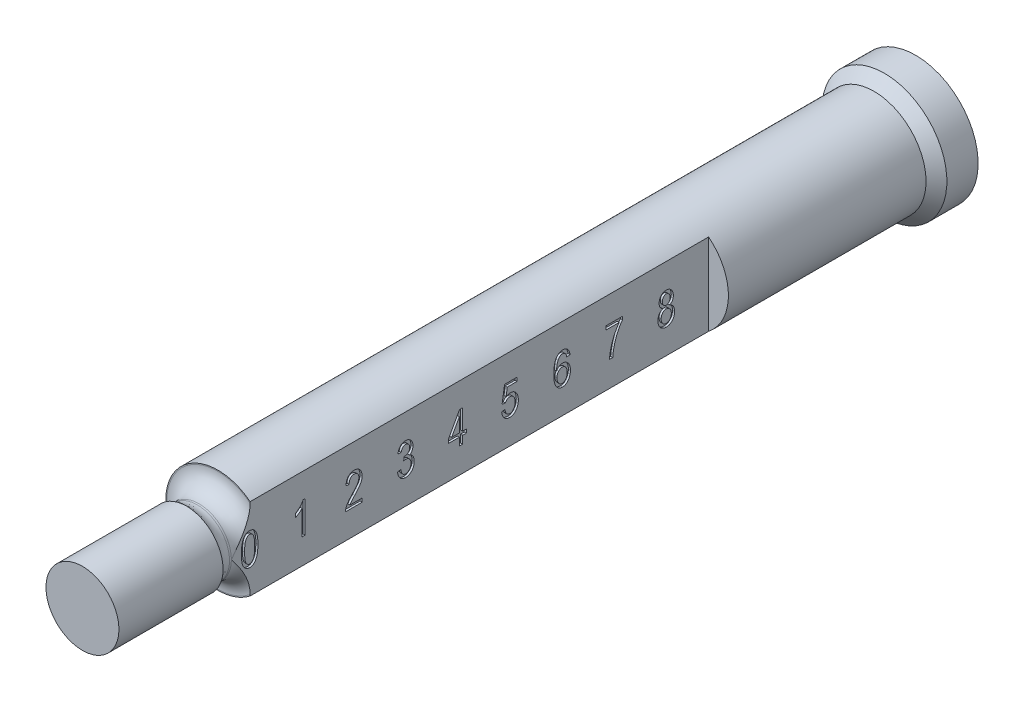
from build123d import *
from build123d.topology import SkipClean

# Parameters (mm, degrees)
FILETE1_R             = 1.5
CHANFRO3_SIZE         = 1
ESBO_O18_W            = 6.121736027
ESBO_O18_H            = 45.822110592
CORTE_EXTRUS_O1_DEPTH = 5
CORTE_EXTRUS_O3_DEPTH = 0.2


# Some blends are built 0.0001 mm under size
with BuildPart() as part:
    # Esboço1 → Revolução1 (revolve)
    with BuildSketch(Plane(origin=(0, 0, 0), x_dir=(1, 0, 0), z_dir=(0, 1, 0)), mode=Mode.PRIVATE) as revolu_o1_sk:
        with BuildLine():
            Line((0, 0), (3.5, 0))
            Line((3.5, 0), (3.5, 10))
            Line((3.5, 10), (3.1, 10))
            Line((3.1, 10), (3.1, 11.2))
            ThreePointArc((3.1, 11.2), (3.627207794, 12.472792206), (4.9, 13))
            Line((4.9, 13), (5, 13))
            Line((5, 13), (5, 76))
            Line((5, 76), (6, 76))
            Line((6, 76), (6, 80))
            Line((6, 80), (0, 80))
            Line((0, 80), (0, 0))
        make_face()
    revolve(revolu_o1_sk.sketch.rotate(Axis((0, 0, -80), (0, 0, 1)), 180), axis=Axis((0, 0, -80), (0, 0, 1)))

    # Filete1
    # the kernel refuses this fillet: 1.5 mm, written as the material it adds along each edge
    with BuildSketch(Plane(origin=(0, 0, -10), x_dir=(-1, 0, 0), z_dir=(0, 1, 0))) as filete1_piece_1:
        with BuildLine():
            CenterArc((4.6, -1.019803903), FILETE1_R, 137.166571934, 42.833428066)
            Line((3.1, -1.019803903), (3.07, -1.019803903))
            Line((3.07, -1.019803903), (3.07, 0))
            Line((3.07, 0), (3.1, 0.03))
            ThreePointArc((3.1, 0.03), (3.3, 0.03), (3.478, 0.020396078))
            Line((3.478, 0.020396078), (3.5, 0))
        make_face()
    revolve(axis=Axis((0, 0, -10), (0, 0, 1)))

    # Chanfro3
    chanfro3_edges = [part.edges().sort_by_distance(p)[0] for p in [
        (6, 0, -76),
    ]]
    chamfer(chanfro3_edges, length=CHANFRO3_SIZE - 0.0001)  # a hair under: the kernel refuses the full size

    # Esboço18 → Corte-extrusão1 (cut, symmetric)
    with SkipClean():  # the faces are left unmerged after this step: merging them gives an invalid solid
        with BuildSketch(Plane(origin=(0, 0, 0), x_dir=(1, 0, 0), z_dir=(0, 1, 0))):
            with Locations((6.160868014, 34.111055296)):
                Rectangle(ESBO_O18_W, ESBO_O18_H)
        extrude(amount=CORTE_EXTRUS_O1_DEPTH, both=True, mode=Mode.SUBTRACT)

    # Esboço21 → Corte-extrusão3 (cut)
    # profile 1 of 9: a face of its own
    with SkipClean():  # the faces are left unmerged after this step: merging them gives an invalid solid
        with BuildSketch(Plane(origin=(3.1, 0, 0), x_dir=(0, 0, -1), z_dir=(1, 0, 0))):
            with BuildLine():
                Line((18.285714286, -1.502061866), (17.974025974, -1.502061866))
                Line((17.974025974, -1.502061866), (17.974025974, 0.87456151))
                add(Edge.make_bspline(
                    [(17.974025974, 0.87456151), (17.954884057, 0.852527522), (17.915212453, 0.806862104), (17.846344584, 0.741919516), (17.769598952, 0.674950457), (17.684631348, 0.609966813), (17.598056123, 0.547722997), (17.512546999, 0.492978478), (17.43130882, 0.44534662), (17.376809469, 0.419456503), (17.350649351, 0.407029043)],
                    knots=[0, 0, 0, 0, 0.892555828, 1.849821039, 2.893015883, 4.008277588, 5.121255548, 6.154629642, 7.114207698, 8, 8, 8, 8], degree=3))
                Line((17.350649351, 0.407029043), (17.350649351, 0.757678393))
                add(Edge.make_bspline(
                    [(17.350649351, 0.757678393), (17.392690771, 0.78298052), (17.47641362, 0.833368117), (17.59372029, 0.920655707), (17.704538385, 1.01486831), (17.80555558, 1.116993064), (17.896005383, 1.222268396), (17.973640529, 1.327333306), (18.037296431, 1.431071497), (18.068521688, 1.502431404), (18.083603896, 1.536899173)],
                    knots=[0, 0, 0, 0, 1.082272232, 2.155277244, 3.222407096, 4.289527553, 5.32168536, 6.282742408, 7.170542132, 8, 8, 8, 8], degree=3))
                Line((18.083603896, 1.536899173), (18.285714286, 1.536899173))
                Line((18.285714286, 1.536899173), (18.285714286, -1.502061866))
            make_face()
        # profile 2 of 9: a face of its own
        with BuildSketch(Plane(origin=(3.1, 0, 0), x_dir=(0, 0, -1), z_dir=(1, 0, 0))):
            with BuildLine():
                Line((23.753246753, -1.151412516), (23.753246753, -1.502061866))
                Line((23.753246753, -1.502061866), (22.155844156, -1.502061866))
                add(Edge.make_bspline(
                    [(22.155844156, -1.502061866), (22.155770195, -1.483791568), (22.155620349, -1.446775645), (22.160602247, -1.390341604), (22.170837984, -1.332541261), (22.183907975, -1.272603553), (22.202439798, -1.211316787), (22.225126186, -1.148383176), (22.25189413, -1.083959398), (22.283236949, -1.017663913), (22.319862612, -0.948860806), (22.364059171, -0.877837935), (22.414851977, -0.803321312), (22.472308202, -0.725765211), (22.537551555, -0.645905162), (22.608645544, -0.56255565), (22.686604776, -0.475890277), (22.742111915, -0.418291667), (22.770698052, -0.388628425)],
                    knots=[0, 0, 0, 0, 0.672188691, 1.361865275, 2.08134618, 2.831455259, 3.618325166, 4.435686407, 5.292818481, 6.184803937, 7.133719261, 8.159707436, 9.261705982, 10.452168352, 11.710682541, 13.056179633, 14.483934645, 16, 16, 16, 16], degree=3))
                add(Edge.make_bspline(
                    [(22.770698052, -0.388628425), (22.803918347, -0.354267715), (22.867881441, -0.28810884), (22.957903388, -0.190421207), (23.039697368, -0.099621766), (23.11162919, -0.014068595), (23.174975907, 0.065073096), (23.230374857, 0.137690152), (23.275178523, 0.205430572), (23.323553744, 0.285136905), (23.369672644, 0.380026033), (23.410444365, 0.490634325), (23.436788116, 0.597559628), (23.439999288, 0.668053203), (23.441558442, 0.702280666)],
                    knots=[0, 0, 0, 0, 1.312560889, 2.527233899, 3.64818266, 4.668586789, 5.596397896, 6.432357998, 7.175835261, 7.825761013, 8.992224112, 10.065918602, 11.060925749, 12, 12, 12, 12], degree=3))
                add(Edge.make_bspline(
                    [(23.441558442, 0.702280666), (23.441341039, 0.72117695), (23.440916429, 0.758083371), (23.433700773, 0.81198125), (23.423410297, 0.863246481), (23.409823819, 0.912249567), (23.39055976, 0.958185623), (23.367478168, 1.001373353), (23.340441359, 1.042008362), (23.309588254, 1.079493908), (23.275564298, 1.113310555), (23.239707823, 1.143690565), (23.201086051, 1.168278735), (23.161286346, 1.189683235), (23.118963799, 1.205195907), (23.075009612, 1.217020574), (23.029017125, 1.22368786), (22.997787906, 1.224698161), (22.981939935, 1.225210861)],
                    knots=[0, 0, 0, 0, 1.164486654, 2.274364258, 3.346924328, 4.388668322, 5.404300818, 6.412115579, 7.404820287, 8.409522099, 9.400647826, 10.360464378, 11.301161788, 12.219192522, 13.141987859, 14.073903283, 15.022558797, 16, 16, 16, 16], degree=3))
                add(Edge.make_bspline(
                    [(22.981939935, 1.225210861), (22.964852714, 1.224852392), (22.931497675, 1.224152643), (22.882880529, 1.215456664), (22.836296374, 1.203823162), (22.791981598, 1.185780615), (22.750260343, 1.16266921), (22.710531593, 1.134850237), (22.673572987, 1.101797858), (22.638640025, 1.064213347), (22.608016834, 1.021355093), (22.579900252, 0.974977777), (22.557759628, 0.923116858), (22.53893371, 0.867371467), (22.524190054, 0.807091799), (22.514335097, 0.742505193), (22.507107969, 0.673627396), (22.506702094, 0.626205415), (22.506493506, 0.601834238)],
                    knots=[0, 0, 0, 0, 0.928788257, 1.813037313, 2.680996359, 3.53827917, 4.408273621, 5.272359245, 6.172129225, 7.102295458, 8.058839945, 9.034325244, 10.048074492, 11.120300332, 12.234644845, 13.420320921, 14.674247329, 16, 16, 16, 16], degree=3))
                Line((22.506493506, 0.601834238), (22.194805195, 0.640795276))
                add(Edge.make_bspline(
                    [(22.194805195, 0.640795276), (22.198017295, 0.676964227), (22.204248914, 0.747133633), (22.220598949, 0.848714741), (22.243287566, 0.942963812), (22.270220371, 1.030821093), (22.304104943, 1.111196232), (22.341988968, 1.185551964), (22.386890613, 1.252271928), (22.436963355, 1.312180969), (22.491787855, 1.365332504), (22.551055115, 1.411211718), (22.614684654, 1.449887029), (22.681949816, 1.48240673), (22.754241008, 1.506690992), (22.830261324, 1.524315965), (22.910629066, 1.534757842), (22.96547262, 1.536174853), (22.993506494, 1.536899173)],
                    knots=[0, 0, 0, 0, 1.296155121, 2.514599762, 3.669097984, 4.755193195, 5.79120272, 6.77953026, 7.729955905, 8.65570694, 9.562583864, 10.450894749, 11.325630111, 12.216772649, 13.112585423, 14.04224033, 14.999270054, 16, 16, 16, 16], degree=3))
                add(Edge.make_bspline(
                    [(22.993506494, 1.536899173), (23.023774965, 1.536010674), (23.082712706, 1.534280621), (23.168512166, 1.522880945), (23.248535847, 1.502772684), (23.323141184, 1.474791728), (23.391432191, 1.43795557), (23.454519683, 1.393769591), (23.511350804, 1.340890585), (23.561925315, 1.280721739), (23.606620465, 1.215762244), (23.645619905, 1.147836952), (23.679448787, 1.078071376), (23.705887015, 1.005689217), (23.727965749, 0.931661901), (23.741836093, 0.854867269), (23.751600714, 0.776191391), (23.752694975, 0.723009733), (23.753246753, 0.696193004)],
                    knots=[0, 0, 0, 0, 1.141256367, 2.222215694, 3.255808886, 4.246221905, 5.218350639, 6.173592628, 7.142736081, 8.136099926, 9.131465336, 10.11177911, 11.087094076, 12.050634184, 13.014356534, 13.995714735, 14.989343724, 16, 16, 16, 16], degree=3))
                add(Edge.make_bspline(
                    [(23.753246753, 0.696193004), (23.752726873, 0.672032304), (23.751693886, 0.624025679), (23.744974219, 0.552397073), (23.733112761, 0.481731457), (23.717711181, 0.411349362), (23.695856232, 0.342340552), (23.671115265, 0.273609), (23.641106391, 0.205930091), (23.605680168, 0.137982745), (23.564200664, 0.067362472), (23.514494499, -0.007219626), (23.457483477, -0.087757158), (23.390851898, -0.172815124), (23.317828394, -0.264839553), (23.23518691, -0.361511696), (23.144539831, -0.463684031), (23.080676325, -0.533011238), (23.047686688, -0.56882323)],
                    knots=[0, 0, 0, 0, 0.78053567, 1.550902233, 2.321464013, 3.094364546, 3.87611052, 4.657966429, 5.453363508, 6.265521698, 7.132350641, 8.097801917, 9.160103787, 10.319208993, 11.587678713, 12.955014444, 14.427067756, 16, 16, 16, 16], degree=3))
                add(Edge.make_bspline(
                    [(23.047686688, -0.56882323), (23.026743739, -0.591105508), (22.986720081, -0.633688731), (22.930041786, -0.695307188), (22.879180977, -0.751360732), (22.833030322, -0.801060234), (22.793871404, -0.846077087), (22.759921092, -0.885222113), (22.732181081, -0.918977809), (22.690607511, -0.972043875), (22.638172469, -1.04681348), (22.601946251, -1.117301706), (22.584415584, -1.151412516)],
                    knots=[0, 0, 0, 0, 1.227496676, 2.345844757, 3.360613726, 4.265798447, 5.068085109, 5.75545707, 6.345771879, 6.821573405, 8.46188917, 10, 10, 10, 10], degree=3))
                Line((22.584415584, -1.151412516), (23.753246753, -1.151412516))
            make_face()
        # profile 3 of 9: a face of its own
        with BuildSketch(Plane(origin=(3.1, 0, 0), x_dir=(0, 0, -1), z_dir=(1, 0, 0))):
            with BuildLine():
                Line((27.155844156, -0.683880048), (27.467532468, -0.644919009))
                add(Edge.make_bspline(
                    [(27.467532468, -0.644919009), (27.471552394, -0.668505664), (27.479385759, -0.714467421), (27.494798349, -0.780608348), (27.511619738, -0.842499064), (27.5311161, -0.899556932), (27.552367704, -0.952339277), (27.5759343, -1.000509547), (27.602282626, -1.044059679), (27.630764128, -1.083014915), (27.661466779, -1.117559729), (27.694250914, -1.147467839), (27.729423569, -1.172717851), (27.766649458, -1.193731246), (27.806517673, -1.209319867), (27.848244872, -1.221217085), (27.89244416, -1.227834122), (27.922666072, -1.228827169), (27.938108766, -1.229334594)],
                    knots=[0, 0, 0, 0, 1.392235382, 2.712957193, 3.95076201, 5.123471921, 6.220028287, 7.260520794, 8.240826993, 9.178593426, 10.065213643, 10.926376853, 11.755607984, 12.580369742, 13.407158359, 14.241002189, 15.101193065, 16, 16, 16, 16], degree=3))
                add(Edge.make_bspline(
                    [(27.938108766, -1.229334594), (27.954999118, -1.229013219), (27.988197392, -1.22838155), (28.036847198, -1.218971299), (28.08411317, -1.206124175), (28.12918029, -1.186114295), (28.172842137, -1.161527232), (28.215153395, -1.13186341), (28.254451325, -1.095191708), (28.292719996, -1.054879992), (28.328015697, -1.010127903), (28.35844893, -0.961248778), (28.384079682, -0.90895904), (28.405587418, -0.853884065), (28.420978689, -0.795128632), (28.433657467, -0.733863688), (28.440017353, -0.668794205), (28.441036199, -0.624434582), (28.441558442, -0.601696607)],
                    knots=[0, 0, 0, 0, 0.904038564, 1.776903143, 2.648138989, 3.525264603, 4.411852617, 5.332561374, 6.2875971, 7.288147468, 8.311042921, 9.337403868, 10.368883854, 11.429611823, 12.501164111, 13.621320171, 14.780729868, 16, 16, 16, 16], degree=3))
                add(Edge.make_bspline(
                    [(28.441558442, -0.601696607), (28.441006396, -0.580377105), (28.43993158, -0.538868716), (28.434019935, -0.478153326), (28.423188385, -0.420631439), (28.407004445, -0.366460179), (28.387839637, -0.314805109), (28.363377302, -0.26672086), (28.33451028, -0.221932221), (28.30185186, -0.18075708), (28.265795281, -0.143648542), (28.227769189, -0.110618832), (28.18715703, -0.083170101), (28.144982188, -0.060057771), (28.100094534, -0.043444399), (28.053802151, -0.030220589), (28.005101784, -0.022916979), (27.972019229, -0.022006523), (27.955154221, -0.021542386)],
                    knots=[0, 0, 0, 0, 1.208507307, 2.352925112, 3.453685551, 4.520081629, 5.553915499, 6.572344605, 7.570902253, 8.569592363, 9.545641393, 10.499968035, 11.418701314, 12.319183888, 13.218416966, 14.125267075, 15.044288268, 16, 16, 16, 16], degree=3))
                add(Edge.make_bspline(
                    [(27.955154221, -0.021542386), (27.939903909, -0.022022334), (27.907394439, -0.023045452), (27.856203653, -0.031893463), (27.799551424, -0.044329243), (27.760670656, -0.056532334), (27.74025974, -0.06293849)],
                    knots=[0, 0, 0, 0, 0.832645691, 1.774971563, 2.831945141, 4, 4, 4, 4], degree=3))
                Line((27.74025974, -0.06293849), (27.779220779, 0.290145926))
                Line((27.779220779, 0.290145926), (27.826095779, 0.285884562))
                add(Edge.make_bspline(
                    [(27.826095779, 0.285884562), (27.844184679, 0.28608971), (27.879482237, 0.286490022), (27.931105589, 0.293887609), (27.980350223, 0.303688399), (28.026717915, 0.318562954), (28.070772283, 0.336847819), (28.111826961, 0.36002444), (28.150630938, 0.387049069), (28.186490371, 0.417923012), (28.218681721, 0.452827307), (28.247438456, 0.490297673), (28.271208351, 0.530919749), (28.290960137, 0.573899109), (28.306105197, 0.619856924), (28.317157914, 0.668551745), (28.323032706, 0.720198552), (28.324118415, 0.755432985), (28.324675325, 0.773506315)],
                    knots=[0, 0, 0, 0, 1.104467345, 2.155189185, 3.181695374, 4.170183668, 5.126157628, 6.092295424, 7.04536858, 8.012620263, 8.977961638, 9.942904556, 10.893715412, 11.848320646, 12.828840281, 13.845861792, 14.895045293, 16, 16, 16, 16], degree=3))
                add(Edge.make_bspline(
                    [(28.324675325, 0.773506315), (28.323278341, 0.805880532), (28.32059359, 0.868097984), (28.299985049, 0.956713773), (28.264073732, 1.035152557), (28.214637246, 1.102215836), (28.155146784, 1.156258161), (28.088688892, 1.19675707), (28.014985057, 1.220752763), (27.963646104, 1.223706546), (27.9375, 1.225210861)],
                    knots=[0, 0, 0, 0, 1.168747258, 2.246123166, 3.262822778, 4.26410748, 5.234436762, 6.148309006, 7.056963545, 8, 8, 8, 8], degree=3))
                add(Edge.make_bspline(
                    [(27.9375, 1.225210861), (27.910331835, 1.223947659), (27.857480336, 1.221490295), (27.781906113, 1.198048076), (27.712376927, 1.162137279), (27.66169299, 1.118945645), (27.625776084, 1.07805238), (27.600434014, 1.043593129), (27.57791537, 1.005274825), (27.55883066, 0.962755321), (27.540462672, 0.917208427), (27.527472598, 0.867080305), (27.514497662, 0.813898696), (27.50921804, 0.776815215), (27.506493506, 0.757678393)],
                    knots=[0, 0, 0, 0, 1.389180941, 2.702438466, 4.019316734, 5.377896697, 6.085434137, 6.807430375, 7.567469407, 8.358691296, 9.195188439, 10.081130764, 11.009773198, 12, 12, 12, 12], degree=3))
                Line((27.506493506, 0.757678393), (27.194805195, 0.796639432))
                add(Edge.make_bspline(
                    [(27.194805195, 0.796639432), (27.199908886, 0.826341895), (27.209864663, 0.88428253), (27.230664609, 0.96765591), (27.255419301, 1.045543867), (27.285391297, 1.117517508), (27.319423147, 1.184201664), (27.357927022, 1.245314916), (27.400401411, 1.301258494), (27.448321927, 1.350487229), (27.499253367, 1.394332785), (27.553225311, 1.432198616), (27.609275476, 1.464790984), (27.668327702, 1.491047958), (27.729827498, 1.511868513), (27.794082792, 1.526438579), (27.860763428, 1.535051906), (27.906021822, 1.536277527), (27.928977273, 1.536899173)],
                    knots=[0, 0, 0, 0, 1.259750421, 2.457396855, 3.589696629, 4.673763457, 5.713494597, 6.716289503, 7.690389722, 8.644478697, 9.583164327, 10.496506905, 11.397350125, 12.289843847, 13.194037124, 14.107891875, 15.040306322, 16, 16, 16, 16], degree=3))
                add(Edge.make_bspline(
                    [(27.928977273, 1.536899173), (27.953164852, 1.536185695), (28.000750225, 1.534782036), (28.070690753, 1.524011882), (28.137954468, 1.507224787), (28.202362299, 1.482750237), (28.26334175, 1.450511342), (28.322394874, 1.412707088), (28.378525965, 1.367413091), (28.4308553, 1.315369359), (28.478888951, 1.258418847), (28.521019599, 1.197228643), (28.557206044, 1.132831774), (28.585940584, 1.064295377), (28.60840058, 0.992311364), (28.624812976, 0.916762669), (28.634862914, 0.837496013), (28.635855804, 0.783479747), (28.636363636, 0.755852095)],
                    knots=[0, 0, 0, 0, 0.987546189, 1.94284647, 2.883618689, 3.814886987, 4.749064414, 5.696240478, 6.674807358, 7.688712876, 8.706405422, 9.713376545, 10.718845743, 11.717906576, 12.742863162, 13.794678478, 14.872046121, 16, 16, 16, 16], degree=3))
                add(Edge.make_bspline(
                    [(28.636363636, 0.755852095), (28.635425879, 0.722492836), (28.633594454, 0.657342693), (28.61594143, 0.562836918), (28.587926131, 0.474174348), (28.548851702, 0.391944724), (28.500160412, 0.316570506), (28.44167609, 0.249897641), (28.374929967, 0.190799311), (28.324179152, 0.15975233), (28.298498377, 0.14404203)],
                    knots=[0, 0, 0, 0, 1.090109576, 2.128968013, 3.132278696, 4.123864162, 5.09769889, 6.057339906, 7.016980922, 8, 8, 8, 8], degree=3))
                add(Edge.make_bspline(
                    [(28.298498377, 0.14404203), (28.322087846, 0.136783797), (28.368178675, 0.122602133), (28.431764451, 0.090665739), (28.489743837, 0.053577667), (28.541549473, 0.009092085), (28.587625485, -0.042806065), (28.628768375, -0.102477144), (28.664117579, -0.170491451), (28.696053791, -0.245153791), (28.72108123, -0.326410992), (28.740309629, -0.412638465), (28.751213337, -0.50381021), (28.752558684, -0.566157068), (28.753246753, -0.598044009)],
                    knots=[0, 0, 0, 0, 0.945190562, 1.846782401, 2.71900073, 3.580139159, 4.456653473, 5.37426406, 6.352713278, 7.392141409, 8.485180558, 9.608884637, 10.777077804, 12, 12, 12, 12], degree=3))
                add(Edge.make_bspline(
                    [(28.753246753, -0.598044009), (28.752649741, -0.631970471), (28.751484189, -0.698205426), (28.739295231, -0.795285763), (28.72084803, -0.887621771), (28.694533411, -0.975543511), (28.660528965, -1.058370769), (28.61853581, -1.13657722), (28.569439486, -1.210170959), (28.512913015, -1.278119809), (28.451104652, -1.338957803), (28.386336565, -1.393324679), (28.318119741, -1.438934125), (28.247035186, -1.476613605), (28.172764969, -1.505225789), (28.095706522, -1.526136862), (28.015414024, -1.538487591), (27.96087819, -1.540170157), (27.933238636, -1.541022905)],
                    knots=[0, 0, 0, 0, 1.16797173, 2.280242353, 3.364490462, 4.408173669, 5.436152277, 6.443028727, 7.460738993, 8.478233232, 9.481512989, 10.444418881, 11.386528098, 12.302557467, 13.209825675, 14.12198051, 15.04819242, 16, 16, 16, 16], degree=3))
                add(Edge.make_bspline(
                    [(27.933238636, -1.541022905), (27.907629426, -1.540346668), (27.857184759, -1.539014624), (27.783123091, -1.527701209), (27.712057002, -1.509544006), (27.644253759, -1.483647517), (27.578921384, -1.451263567), (27.517072436, -1.410940726), (27.457937052, -1.363441531), (27.402370727, -1.309090554), (27.351593979, -1.248249803), (27.305474163, -1.182657707), (27.264964684, -1.111968169), (27.231989949, -1.035489213), (27.203771198, -0.954750642), (27.181202969, -0.869108946), (27.164652729, -0.778323168), (27.158821136, -0.715798419), (27.155844156, -0.683880048)],
                    knots=[0, 0, 0, 0, 0.959274814, 1.889566238, 2.800731978, 3.703256649, 4.604498869, 5.528396462, 6.464265966, 7.442996794, 8.436156864, 9.429840861, 10.444772988, 11.483305447, 12.546329121, 13.647537524, 14.799087218, 16, 16, 16, 16], degree=3))
            make_face()
        # profile 4 of 9: a face of its own
        with BuildSketch(Plane(origin=(3.1, 0, 0), x_dir=(0, 0, -1), z_dir=(1, 0, 0))):
            Polygon((33.090909091, -1.502061866), (33.090909091, -0.761802126), (32.038961039, -0.761802126), (32.038961039, -0.411152775), (33.108563312, 1.536899173), (33.402597403, 1.536899173), (33.402597403, -0.411152775), (33.753246753, -0.411152775), (33.753246753, -0.761802126), (33.402597403, -0.761802126), (33.402597403, -1.502061866), align=None)
            Polygon((33.090909091, -0.411152775), (33.090909091, 0.944569627), (32.346387987, -0.411152775), align=None, mode=Mode.SUBTRACT)
        # profile 5 of 9: a face of its own
        with BuildSketch(Plane(origin=(3.1, 0, 0), x_dir=(0, 0, -1), z_dir=(1, 0, 0))):
            with BuildLine():
                Line((37.155844156, -0.683880048), (37.467532468, -0.644919009))
                add(Edge.make_bspline(
                    [(37.467532468, -0.644919009), (37.470696097, -0.668709223), (37.476861463, -0.715072223), (37.490591559, -0.78181395), (37.505735747, -0.844352107), (37.525956103, -0.901458124), (37.546469246, -0.9549673), (37.571827798, -1.002909857), (37.598970442, -1.046703518), (37.629812923, -1.084921447), (37.661842302, -1.119309284), (37.695960865, -1.148404386), (37.73127551, -1.173181351), (37.767563602, -1.194018208), (37.805582152, -1.210030737), (37.844901408, -1.220868831), (37.88530586, -1.227846559), (37.912715079, -1.228835635), (37.926542208, -1.229334594)],
                    knots=[0, 0, 0, 0, 1.411223046, 2.750228965, 4.006672634, 5.191927097, 6.311278306, 7.373684419, 8.377051755, 9.337097037, 10.257438676, 11.13782359, 11.969011532, 12.792190119, 13.594685164, 14.388253401, 15.186922146, 16, 16, 16, 16], degree=3))
                add(Edge.make_bspline(
                    [(37.926542208, -1.229334594), (37.943833896, -1.228769261), (37.978054516, -1.227650456), (38.028343526, -1.218106878), (38.077001529, -1.203042788), (38.123279984, -1.180602297), (38.168131304, -1.153105821), (38.211126543, -1.119295453), (38.251592812, -1.078797751), (38.290584628, -1.033239329), (38.326662362, -0.982533172), (38.356796323, -0.925942306), (38.382999097, -0.865464824), (38.405270593, -0.800690054), (38.421359034, -0.7310696), (38.432656229, -0.657180306), (38.440312937, -0.578925272), (38.441135505, -0.525214082), (38.441558442, -0.497597581)],
                    knots=[0, 0, 0, 0, 0.833557162, 1.649627401, 2.46080936, 3.284070299, 4.12358479, 4.995082037, 5.915776015, 6.88098611, 7.885890802, 8.910954604, 9.967600199, 11.063514457, 12.210406555, 13.409466691, 14.668034258, 16, 16, 16, 16], degree=3))
                add(Edge.make_bspline(
                    [(38.441558442, -0.497597581), (38.441076015, -0.471810496), (38.440136069, -0.421567634), (38.433278742, -0.348368713), (38.422690294, -0.279504768), (38.406915394, -0.215073141), (38.385893618, -0.155439349), (38.361986154, -0.099581235), (38.332458342, -0.048564946), (38.298294529, -0.002650885), (38.261534623, 0.038891651), (38.22140118, 0.074461003), (38.179459752, 0.104921743), (38.135281762, 0.13064514), (38.088031961, 0.148956216), (38.039095012, 0.163571911), (37.987453654, 0.171236918), (37.952334428, 0.172579392), (37.934456169, 0.173262809)],
                    knots=[0, 0, 0, 0, 1.312040837, 2.556345105, 3.737883698, 4.854849349, 5.925960309, 6.952388988, 7.9424386, 8.917239489, 9.860521384, 10.760061641, 11.639947922, 12.495504232, 13.352616949, 14.212152034, 15.089854369, 16, 16, 16, 16], degree=3))
                add(Edge.make_bspline(
                    [(37.934456169, 0.173262809), (37.912867702, 0.172324365), (37.869800902, 0.170452263), (37.806203641, 0.155281076), (37.745122078, 0.129885712), (37.686691835, 0.095783081), (37.6323305, 0.053220972), (37.583992053, 0.001855185), (37.540889269, -0.056689658), (37.518107183, -0.100343872), (37.506493506, -0.122597581)],
                    knots=[0, 0, 0, 0, 0.943378558, 1.881944462, 2.841095037, 3.827409543, 4.832274565, 5.849176661, 6.903569879, 8, 8, 8, 8], degree=3))
                Line((37.506493506, -0.122597581), (37.194805195, -0.078157646))
                Line((37.194805195, -0.078157646), (37.428571429, 1.458977095))
                Line((37.428571429, 1.458977095), (38.636363636, 1.458977095))
                Line((38.636363636, 1.458977095), (38.636363636, 1.108327744))
                Line((38.636363636, 1.108327744), (37.689732143, 1.108327744))
                Line((37.689732143, 1.108327744), (37.57711039, 0.367459238))
                add(Edge.make_bspline(
                    [(37.57711039, 0.367459238), (37.612222837, 0.385416036), (37.681713217, 0.420953996), (37.792281777, 0.457964441), (37.905911836, 0.480803413), (37.982847919, 0.483563916), (38.02150974, 0.484951121)],
                    knots=[0, 0, 0, 0, 1.017619267, 2.013951072, 3.001973272, 4, 4, 4, 4], degree=3))
                add(Edge.make_bspline(
                    [(38.02150974, 0.484951121), (38.045708732, 0.484097826), (38.093803393, 0.482401933), (38.164501571, 0.46987117), (38.232873429, 0.449812733), (38.298600189, 0.420712422), (38.36171629, 0.383472733), (38.422694042, 0.338383248), (38.481238298, 0.28536093), (38.536101229, 0.223877813), (38.587238252, 0.156240306), (38.631883724, 0.081977693), (38.669774699, 0.00209322), (38.69984141, -0.08379508), (38.724608904, -0.174820741), (38.74133526, -0.271834978), (38.750951875, -0.374430864), (38.752469592, -0.444614146), (38.753246753, -0.480552126)],
                    knots=[0, 0, 0, 0, 0.861018809, 1.711245113, 2.547675859, 3.391805506, 4.262674834, 5.151129072, 6.086914488, 7.068866089, 8.080081396, 9.100796714, 10.1476286, 11.221399762, 12.335728169, 13.501851446, 14.720800604, 16, 16, 16, 16], degree=3))
                add(Edge.make_bspline(
                    [(38.753246753, -0.480552126), (38.752505733, -0.516289385), (38.751045801, -0.586697612), (38.740692598, -0.690308469), (38.722922786, -0.789966759), (38.698546231, -0.885811562), (38.667709677, -0.978015377), (38.629078816, -1.066163856), (38.583306472, -1.150168453), (38.531403859, -1.229707901), (38.473543117, -1.302294936), (38.410574664, -1.366605133), (38.342014521, -1.420263642), (38.268983813, -1.464724976), (38.190982279, -1.499062142), (38.10812823, -1.523370401), (38.020431207, -1.538387085), (37.960288176, -1.5401321), (37.929586039, -1.541022905)],
                    knots=[0, 0, 0, 0, 1.144340564, 2.254537473, 3.330370625, 4.383172833, 5.418849903, 6.440219285, 7.460844228, 8.47914966, 9.47775429, 10.428908251, 11.354479858, 12.258284926, 13.160219244, 14.07516849, 15.0174017, 16, 16, 16, 16], degree=3))
                add(Edge.make_bspline(
                    [(37.929586039, -1.541022905), (37.903984261, -1.540289735), (37.853583283, -1.538846379), (37.779493217, -1.528364916), (37.708462536, -1.510706475), (37.640446151, -1.485645395), (37.575745799, -1.453045398), (37.51374387, -1.413962978), (37.455320076, -1.367277427), (37.399800548, -1.314384041), (37.348786125, -1.254990633), (37.303660836, -1.189294563), (37.263887109, -1.118492354), (37.230366349, -1.04199902), (37.203223561, -0.960159733), (37.181269424, -0.873089779), (37.164581776, -0.780556017), (37.158802474, -0.716611872), (37.155844156, -0.683880048)],
                    knots=[0, 0, 0, 0, 0.958587677, 1.88712499, 2.795765124, 3.694982091, 4.595578744, 5.504218877, 6.434682167, 7.391400486, 8.372260331, 9.360890354, 10.371359061, 11.409147611, 12.483330096, 13.596558593, 14.769722824, 16, 16, 16, 16], degree=3))
            make_face()
        # profile 6 of 9: a face of its own
        with BuildSketch(Plane(origin=(3.1, 0, 0), x_dir=(0, 0, -1), z_dir=(1, 0, 0))):
            with BuildLine():
                Line((43.714285714, 0.796639432), (43.402597403, 0.757678393))
                add(Edge.make_bspline(
                    [(43.402597403, 0.757678393), (43.395392748, 0.793176443), (43.381901728, 0.859648035), (43.352639863, 0.949695981), (43.320036737, 1.024984741), (43.289886657, 1.064933936), (43.275974026, 1.083368328)],
                    knots=[0, 0, 0, 0, 1.230211225, 2.30362229, 3.217213433, 4, 4, 4, 4], degree=3))
                add(Edge.make_bspline(
                    [(43.275974026, 1.083368328), (43.265856494, 1.094756635), (43.246183756, 1.116900294), (43.213487582, 1.145584404), (43.179824193, 1.170305418), (43.144422719, 1.190660372), (43.106865843, 1.205878892), (43.067852715, 1.216771687), (43.027434929, 1.223716021), (43.000027517, 1.22470962), (42.986201299, 1.225210861)],
                    knots=[0, 0, 0, 0, 1.09495211, 2.12904747, 3.12182315, 4.09596367, 5.058329339, 6.028853599, 7.005615717, 8, 8, 8, 8], degree=3))
                add(Edge.make_bspline(
                    [(42.986201299, 1.225210861), (42.964782222, 1.22441615), (42.922346719, 1.222841668), (42.860763898, 1.205867185), (42.802137135, 1.180379159), (42.747286445, 1.143516262), (42.696107203, 1.096582193), (42.647510241, 1.040019663), (42.603323297, 0.972530286), (42.577672019, 0.922904776), (42.564326299, 0.897085861)],
                    knots=[0, 0, 0, 0, 0.906800098, 1.796553483, 2.691003266, 3.610512055, 4.585978966, 5.630213089, 6.767058994, 8, 8, 8, 8], degree=3))
                add(Edge.make_bspline(
                    [(42.564326299, 0.897085861), (42.553125444, 0.872303514), (42.529838622, 0.820780472), (42.502531308, 0.736818152), (42.478534643, 0.644794569), (42.460541556, 0.543906212), (42.444182919, 0.435198395), (42.433752857, 0.317703552), (42.426936081, 0.19201317), (42.426006335, 0.105293843), (42.425527597, 0.060641056)],
                    knots=[0, 0, 0, 0, 0.763508889, 1.587351645, 2.476402758, 3.433472996, 4.464603951, 5.563935012, 6.745641893, 8, 8, 8, 8], degree=3))
                add(Edge.make_bspline(
                    [(42.425527597, 0.060641056), (42.443175753, 0.091025852), (42.47751562, 0.150148735), (42.541505627, 0.227614556), (42.610116336, 0.295126413), (42.686304791, 0.349373531), (42.766726488, 0.391935143), (42.849815055, 0.423476416), (42.935627517, 0.442505975), (42.993616265, 0.444825602), (43.022727273, 0.445990082)],
                    knots=[0, 0, 0, 0, 1.127907175, 2.194687167, 3.21896757, 4.214740698, 5.189497801, 6.137088422, 7.064797308, 8, 8, 8, 8], degree=3))
                add(Edge.make_bspline(
                    [(43.022727273, 0.445990082), (43.046925555, 0.445148331), (43.094618816, 0.443489295), (43.16499772, 0.43093408), (43.232748255, 0.4100552), (43.298499267, 0.381340814), (43.36159721, 0.343578974), (43.422489985, 0.297960797), (43.480413487, 0.243543175), (43.536381939, 0.182698778), (43.587189347, 0.114160758), (43.63175154, 0.039494974), (43.669777262, -0.040516441), (43.699957842, -0.126581876), (43.724429839, -0.217678224), (43.741417002, -0.314635252), (43.750934846, -0.417047879), (43.752463826, -0.487228927), (43.753246753, -0.523165762)],
                    knots=[0, 0, 0, 0, 0.860357646, 1.695709716, 2.533583491, 3.377064945, 4.241047709, 5.143225219, 6.077846286, 7.063889573, 8.080111547, 9.106229702, 10.152257742, 11.225204373, 12.345649275, 13.503769734, 14.721782881, 16, 16, 16, 16], degree=3))
                add(Edge.make_bspline(
                    [(43.753246753, -0.523165762), (43.752003896, -0.571934776), (43.749569271, -0.667468028), (43.729163778, -0.807342769), (43.69480954, -0.940028215), (43.655870826, -1.045186735), (43.618466232, -1.124011018), (43.588516292, -1.17904861), (43.556984905, -1.230174869), (43.523600279, -1.277477449), (43.487347402, -1.319853068), (43.450213798, -1.359372321), (43.410709874, -1.394630713), (43.355957766, -1.435551895), (43.283937346, -1.477837558), (43.191934743, -1.514046729), (43.095675112, -1.536934188), (43.029752173, -1.539653389), (42.996550325, -1.541022905)],
                    knots=[0, 0, 0, 0, 1.657459496, 3.246784879, 4.79287916, 6.310074839, 7.050696599, 7.757650882, 8.439205885, 9.092012499, 9.723586031, 10.333538589, 10.934530017, 11.52093132, 12.655638276, 13.761218907, 14.872446044, 16, 16, 16, 16], degree=3))
                add(Edge.make_bspline(
                    [(42.996550325, -1.541022905), (42.966643806, -1.539977739), (42.90782202, -1.537922049), (42.821750094, -1.521397872), (42.739424079, -1.495539612), (42.661761537, -1.457468947), (42.587063678, -1.410638849), (42.517928999, -1.351379522), (42.452261267, -1.282464939), (42.390300546, -1.203143536), (42.33457654, -1.1107), (42.285956988, -1.004792544), (42.245337448, -0.884576053), (42.213331976, -0.750337185), (42.187079707, -0.602381014), (42.168623681, -0.440563514), (42.157759306, -0.264590972), (42.156498974, -0.142703159), (42.155844156, -0.079375178)],
                    knots=[0, 0, 0, 0, 0.760819453, 1.496421576, 2.223429687, 2.951263266, 3.692179274, 4.462099387, 5.262291211, 6.1127328, 7.019077074, 8.003719522, 9.073773746, 10.244022616, 11.513769144, 12.897217303, 14.387919526, 16, 16, 16, 16], degree=3))
                add(Edge.make_bspline(
                    [(42.155844156, -0.079375178), (42.156420524, -0.00914459), (42.157530808, 0.126143753), (42.169448915, 0.321316972), (42.187482271, 0.500844641), (42.214339505, 0.664657308), (42.247664907, 0.813019042), (42.289597767, 0.94561038), (42.338269321, 1.063011092), (42.39617406, 1.164464377), (42.46001166, 1.252032952), (42.527659778, 1.327996257), (42.599301574, 1.392913424), (42.675713405, 1.445846991), (42.757096355, 1.486222678), (42.842248118, 1.515976615), (42.932144291, 1.533204301), (42.993434828, 1.535654928), (43.024553571, 1.536899173)],
                    knots=[0, 0, 0, 0, 1.648816343, 3.176189159, 4.589499976, 5.883521052, 7.071677735, 8.156616623, 9.145117633, 10.049911772, 10.892392766, 11.685345428, 12.434380955, 13.15730553, 13.86047472, 14.561137348, 15.269453316, 16, 16, 16, 16], degree=3))
                add(Edge.make_bspline(
                    [(43.024553571, 1.536899173), (43.047098418, 1.536255901), (43.091538715, 1.534987888), (43.156934009, 1.526707726), (43.219187095, 1.511128625), (43.278876268, 1.490499957), (43.335432668, 1.463473455), (43.3897259, 1.431264129), (43.440090665, 1.391659496), (43.488301266, 1.347420295), (43.532907279, 1.297508927), (43.572560634, 1.241582195), (43.60772582, 1.180520533), (43.639192287, 1.114344586), (43.665048804, 1.042482103), (43.686187483, 0.96528106), (43.703563178, 0.882990238), (43.710648921, 0.825927282), (43.714285714, 0.796639432)],
                    knots=[0, 0, 0, 0, 0.965625992, 1.903437499, 2.816107718, 3.709373219, 4.603483816, 5.496241877, 6.407089735, 7.341876361, 8.295975248, 9.267838192, 10.27248647, 11.310449055, 12.401896837, 13.538363143, 14.736552469, 16, 16, 16, 16], degree=3))
            make_face()
            with BuildLine():
                add(Edge.make_bspline(
                    [(42.467532468, -0.511599204), (42.467977498, -0.537995806), (42.468845395, -0.589474362), (42.476260654, -0.66476281), (42.488500747, -0.735899857), (42.50455634, -0.803519351), (42.526774051, -0.866658476), (42.552773825, -0.926475492), (42.584627449, -0.981695064), (42.620427298, -1.032887262), (42.659532863, -1.078615879), (42.70079334, -1.118642968), (42.743081248, -1.153002136), (42.787639936, -1.180573706), (42.833287303, -1.203047883), (42.881162929, -1.218013763), (42.930214676, -1.227624655), (42.963429322, -1.228762855), (42.980113636, -1.229334594)],
                    knots=[0, 0, 0, 0, 1.295936842, 2.527331243, 3.710032566, 4.838610101, 5.935196688, 6.992417297, 8.036740745, 9.059547266, 10.056000021, 10.986130286, 11.879343137, 12.725347321, 13.554280309, 14.370418864, 15.181432095, 16, 16, 16, 16], degree=3))
                add(Edge.make_bspline(
                    [(42.980113636, -1.229334594), (42.994961456, -1.228694879), (43.024493965, -1.227422479), (43.068046718, -1.218865556), (43.10995578, -1.203674017), (43.151081578, -1.183688117), (43.190578564, -1.157024283), (43.229336284, -1.125422982), (43.265569037, -1.086881256), (43.301745552, -1.044275514), (43.334099805, -0.995447655), (43.363869717, -0.942758203), (43.387034865, -0.884723041), (43.407632199, -0.823312909), (43.422266116, -0.756916123), (43.43431758, -0.686701906), (43.439865236, -0.611726924), (43.440982749, -0.560508817), (43.441558442, -0.534123555)],
                    knots=[0, 0, 0, 0, 0.772594522, 1.536700729, 2.298102904, 3.086693685, 3.909598938, 4.772126543, 5.683120767, 6.657848237, 7.676972593, 8.726121203, 9.800678132, 10.92259173, 12.09308983, 13.334225679, 14.626713094, 16, 16, 16, 16], degree=3))
                add(Edge.make_bspline(
                    [(43.441558442, -0.534123555), (43.441004127, -0.508343545), (43.439928843, -0.458334336), (43.434100073, -0.385256543), (43.423067315, -0.316734871), (43.408279691, -0.252400288), (43.387708504, -0.193196969), (43.364314399, -0.13780455), (43.335463097, -0.087127097), (43.302622978, -0.041008126), (43.267042378, 0.00029474), (43.228746168, 0.036034274), (43.188933132, 0.066536585), (43.146708254, 0.091178139), (43.1030061, 0.111054484), (43.05657597, 0.124108617), (43.008680897, 0.133249557), (42.975896138, 0.133949777), (42.959415584, 0.13430177)],
                    knots=[0, 0, 0, 0, 1.343777819, 2.606719898, 3.816838752, 4.958326899, 6.041908764, 7.079242616, 8.08798765, 9.073968097, 10.026073332, 10.923948235, 11.799625043, 12.633965371, 13.467232591, 14.293828985, 15.142325764, 16, 16, 16, 16], degree=3))
                add(Edge.make_bspline(
                    [(42.959415584, 0.13430177), (42.943135071, 0.133964331), (42.910947533, 0.133297195), (42.863884092, 0.124032584), (42.818076572, 0.110973338), (42.774304075, 0.090903099), (42.731427794, 0.066680973), (42.690224112, 0.036590933), (42.651591135, 0.000154678), (42.613737832, -0.040232073), (42.579259481, -0.085579031), (42.549259439, -0.135163663), (42.524347245, -0.188552508), (42.503546844, -0.24557231), (42.487040312, -0.306634303), (42.475729211, -0.371639627), (42.468978747, -0.440433718), (42.468023535, -0.487435757), (42.467532468, -0.511599204)],
                    knots=[0, 0, 0, 0, 0.863470541, 1.707132358, 2.539352989, 3.38871181, 4.257816365, 5.15261427, 6.090962397, 7.075009843, 8.09049846, 9.111009759, 10.147788812, 11.215218178, 12.331811356, 13.503305971, 14.716465586, 16, 16, 16, 16], degree=3))
            make_face(mode=Mode.SUBTRACT)
        # profile 7 of 9: a face of its own
        with BuildSketch(Plane(origin=(3.1, 0, 0), x_dir=(0, 0, -1), z_dir=(1, 0, 0))):
            with BuildLine():
                Line((47.155844156, 1.108327744), (47.155844156, 1.458977095))
                Line((47.155844156, 1.458977095), (48.753246753, 1.458977095))
                Line((48.753246753, 1.458977095), (48.753246753, 1.172248199))
                add(Edge.make_bspline(
                    [(48.753246753, 1.172248199), (48.72360869, 1.132568129), (48.663281791, 1.051801193), (48.578916321, 0.922605796), (48.496867272, 0.785010651), (48.417057738, 0.638899436), (48.340425324, 0.483802601), (48.266196665, 0.320206624), (48.195064668, 0.147496184), (48.126985876, -0.0321341), (48.063190829, -0.215858265), (48.006686133, -0.400884514), (47.957206526, -0.585426546), (47.915363358, -0.769475906), (47.879702543, -0.952937763), (47.851834137, -1.136132179), (47.830819881, -1.319101898), (47.822389657, -1.441145407), (47.818181818, -1.502061866)],
                    knots=[0, 0, 0, 0, 0.828235292, 1.685834407, 2.579347319, 3.50739146, 4.469751317, 5.472290501, 6.511687755, 7.593421113, 8.685056077, 9.764080991, 10.828622054, 11.880069368, 12.920502423, 13.954003105, 14.978766756, 16, 16, 16, 16], degree=3))
                Line((47.818181818, -1.502061866), (47.506493506, -1.502061866))
                add(Edge.make_bspline(
                    [(47.506493506, -1.502061866), (47.507456531, -1.469986865), (47.509421099, -1.404553862), (47.517302637, -1.304515541), (47.527237999, -1.200289986), (47.54212699, -1.092337328), (47.560428185, -0.980495013), (47.582668576, -0.8649043), (47.607205651, -0.744973661), (47.646496219, -0.58062555), (47.701874816, -0.374766631), (47.781459855, -0.132363068), (47.871179275, 0.104499746), (47.973290213, 0.332786917), (48.082177515, 0.550277317), (48.196846471, 0.752442319), (48.313966395, 0.938933075), (48.399785157, 1.052868397), (48.441558442, 1.108327744)],
                    knots=[0, 0, 0, 0, 0.54755489, 1.117011975, 1.712111195, 2.334110413, 2.976306168, 3.645990646, 4.342828197, 5.06521062, 6.529487471, 7.979439287, 9.417531512, 10.850025522, 12.245424871, 13.566691952, 14.815558909, 16, 16, 16, 16], degree=3))
                Line((48.441558442, 1.108327744), (47.155844156, 1.108327744))
            make_face()
        # profile 8 of 9: a face of its own
        with BuildSketch(Plane(origin=(3.1, 0, 0), x_dir=(0, 0, -1), z_dir=(1, 0, 0))):
            with BuildLine():
                add(Edge.make_bspline(
                    [(52.637378247, 0.14404203), (52.608699982, 0.158453729), (52.552748196, 0.186571202), (52.478170828, 0.241645174), (52.414578207, 0.30560397), (52.362194537, 0.378908289), (52.321665265, 0.461629599), (52.293486584, 0.553477465), (52.2751641, 0.654273808), (52.273560635, 0.724718875), (52.272727273, 0.761330991)],
                    knots=[0, 0, 0, 0, 1.008302473, 1.967215395, 2.901654035, 3.835241807, 4.788827276, 5.786238528, 6.849451133, 8, 8, 8, 8], degree=3))
                add(Edge.make_bspline(
                    [(52.272727273, 0.761330991), (52.273285364, 0.789359036), (52.274376348, 0.844149706), (52.283687696, 0.924395341), (52.29898066, 1.000466606), (52.319227374, 1.072922647), (52.347237389, 1.14066113), (52.379897277, 1.205283569), (52.419759216, 1.265352269), (52.464569744, 1.321413484), (52.514300706, 1.371639834), (52.567454578, 1.415789323), (52.623860438, 1.453391108), (52.683639154, 1.483704846), (52.746240948, 1.507700851), (52.811914905, 1.524991017), (52.880808321, 1.534514064), (52.9277325, 1.536097231), (52.951501623, 1.536899173)],
                    knots=[0, 0, 0, 0, 1.165528948, 2.278436123, 3.35437051, 4.390847764, 5.401785756, 6.398351761, 7.397951243, 8.394481506, 9.379254266, 10.332413116, 11.264104055, 12.192693114, 13.114390379, 14.047914605, 15.011184464, 16, 16, 16, 16], degree=3))
                add(Edge.make_bspline(
                    [(52.951501623, 1.536899173), (52.975482965, 1.536165862), (53.022858688, 1.534717188), (53.092247591, 1.524196835), (53.158560528, 1.507092963), (53.221798189, 1.483321203), (53.281859611, 1.452014829), (53.338358152, 1.413471339), (53.391993681, 1.368404292), (53.442050792, 1.317107462), (53.487484685, 1.260169804), (53.527087954, 1.198825027), (53.561728035, 1.134183433), (53.588958351, 1.064815962), (53.610342664, 0.991456484), (53.62533239, 0.91401601), (53.634707514, 0.832787389), (53.635804566, 0.777387896), (53.636363636, 0.749155666)],
                    knots=[0, 0, 0, 0, 0.985268531, 1.946421878, 2.87680472, 3.795226773, 4.71648376, 5.65319809, 6.600248485, 7.590936614, 8.593729089, 9.588305238, 10.588007114, 11.602279753, 12.644649782, 13.724021809, 14.840134863, 16, 16, 16, 16], degree=3))
                add(Edge.make_bspline(
                    [(53.636363636, 0.749155666), (53.635474006, 0.713967593), (53.633760335, 0.646185776), (53.616085697, 0.548842188), (53.588570406, 0.459597771), (53.548508725, 0.378955755), (53.497298838, 0.306496612), (53.434409242, 0.242929707), (53.360471391, 0.186836536), (53.304296896, 0.158589925), (53.27536526, 0.14404203)],
                    knots=[0, 0, 0, 0, 1.126288406, 2.16953834, 3.158564267, 4.109347243, 5.041996175, 5.989081932, 6.964313779, 8, 8, 8, 8], degree=3))
                add(Edge.make_bspline(
                    [(53.27536526, 0.14404203), (53.294172869, 0.136433769), (53.33141617, 0.121367701), (53.384157806, 0.093727721), (53.433913798, 0.063441459), (53.479586443, 0.028962647), (53.522541494, -0.008234081), (53.562214496, -0.049038055), (53.598123089, -0.093575466), (53.630324949, -0.141424654), (53.66004341, -0.191882242), (53.684484468, -0.246220321), (53.706216885, -0.302983159), (53.722998615, -0.362971717), (53.736449148, -0.425797075), (53.745967543, -0.491488404), (53.752448123, -0.560170954), (53.752976271, -0.606956829), (53.753246753, -0.630917386)],
                    knots=[0, 0, 0, 0, 0.998518868, 1.977292132, 2.928488769, 3.863806314, 4.791620617, 5.724425947, 6.662355446, 7.604692757, 8.562792825, 9.541974082, 10.534927333, 11.553397264, 12.605860047, 13.696849039, 14.820482036, 16, 16, 16, 16], degree=3))
                add(Edge.make_bspline(
                    [(53.753246753, -0.630917386), (53.752494064, -0.663609514), (53.75101754, -0.727740503), (53.740947548, -0.821747956), (53.722274733, -0.911011962), (53.697712724, -0.995986442), (53.665128976, -1.0759599), (53.62612442, -1.151716579), (53.578978869, -1.222234185), (53.525540617, -1.287837692), (53.467124632, -1.347092301), (53.40436778, -1.398732935), (53.338451712, -1.442867259), (53.268769851, -1.479236751), (53.195137618, -1.506279919), (53.118640197, -1.526910458), (53.038489638, -1.538299366), (52.984002013, -1.540106514), (52.956371753, -1.541022905)],
                    knots=[0, 0, 0, 0, 1.159749967, 2.275040396, 3.347967098, 4.391166783, 5.408413163, 6.406504519, 7.408740576, 8.411571025, 9.404143995, 10.355316395, 11.289670068, 12.213679047, 13.136228826, 14.066859406, 15.019719104, 16, 16, 16, 16], degree=3))
                add(Edge.make_bspline(
                    [(52.956371753, -1.541022905), (52.928334549, -1.540116678), (52.873237547, -1.538335816), (52.792294033, -1.52688558), (52.715328437, -1.506418566), (52.641428166, -1.479058566), (52.571328171, -1.443086586), (52.505308773, -1.398507636), (52.441963235, -1.347334068), (52.383653061, -1.287756435), (52.329777837, -1.222382477), (52.283840004, -1.150695928), (52.243604895, -1.074802768), (52.211533943, -0.993472591), (52.186463363, -0.907259078), (52.169140327, -0.815923256), (52.15780694, -0.719878764), (52.156506557, -0.654083696), (52.155844156, -0.62056836)],
                    knots=[0, 0, 0, 0, 0.984972937, 1.935608695, 2.864070717, 3.777636659, 4.698984135, 5.624239024, 6.571662262, 7.554569506, 8.54763434, 9.542156389, 10.540146702, 11.560717074, 12.60743999, 13.689489912, 14.823049757, 16, 16, 16, 16], degree=3))
                add(Edge.make_bspline(
                    [(52.155844156, -0.62056836), (52.156138535, -0.596002208), (52.156716088, -0.547804949), (52.162913936, -0.477029998), (52.173244818, -0.409550603), (52.187190717, -0.345474374), (52.204783529, -0.284739389), (52.226745588, -0.2273038), (52.252884507, -0.173169279), (52.282940903, -0.122345788), (52.316190837, -0.075002314), (52.352806964, -0.031550631), (52.392691348, 0.007615297), (52.435479223, 0.043008262), (52.481238545, 0.075049741), (52.530595585, 0.102130066), (52.582708199, 0.125621882), (52.619000197, 0.137849857), (52.637378247, 0.14404203)],
                    knots=[0, 0, 0, 0, 1.21084686, 2.375606163, 3.49898943, 4.574306622, 5.606312177, 6.613285576, 7.602106595, 8.566331322, 9.521116698, 10.451051306, 11.363604456, 12.273026677, 13.186018397, 14.112988761, 15.044428814, 16, 16, 16, 16], degree=3))
            make_face()
            with BuildLine():
                add(Edge.make_bspline(
                    [(52.584415584, 0.769853718), (52.585585953, 0.735053404), (52.587825365, 0.668465643), (52.607923661, 0.573793442), (52.642155657, 0.490395919), (52.689013566, 0.419062953), (52.746337475, 0.362450939), (52.810272762, 0.31994703), (52.881477161, 0.294397943), (52.931212208, 0.291574318), (52.956371753, 0.290145926)],
                    knots=[0, 0, 0, 0, 1.231806288, 2.356967922, 3.407623546, 4.408504678, 5.359070988, 6.242373184, 7.110866593, 8, 8, 8, 8], degree=3))
                add(Edge.make_bspline(
                    [(52.956371753, 0.290145926), (52.981148877, 0.291542965), (53.030139608, 0.294305271), (53.099815693, 0.320326563), (53.163630839, 0.361020749), (53.21965434, 0.417328283), (53.266540803, 0.486170326), (53.300896126, 0.565831015), (53.321200346, 0.65500993), (53.323488078, 0.717391002), (53.324675325, 0.749764432)],
                    knots=[0, 0, 0, 0, 0.904069307, 1.787576968, 2.686104763, 3.657927982, 4.673759711, 5.718490521, 6.815982417, 8, 8, 8, 8], degree=3))
                add(Edge.make_bspline(
                    [(53.324675325, 0.749764432), (53.323534235, 0.783158185), (53.32133216, 0.847601479), (53.300416847, 0.939396294), (53.265357044, 1.021730351), (53.216544855, 1.092309108), (53.159672755, 1.150987736), (53.095597119, 1.193626243), (53.025962537, 1.220418979), (52.977302086, 1.223602545), (52.952719156, 1.225210861)],
                    knots=[0, 0, 0, 0, 1.195037322, 2.306184118, 3.351541185, 4.382027117, 5.363972266, 6.261309376, 7.121625266, 8, 8, 8, 8], degree=3))
                add(Edge.make_bspline(
                    [(52.952719156, 1.225210861), (52.92815205, 1.223798891), (52.879570401, 1.221006709), (52.809987688, 1.195049976), (52.746567587, 1.152811015), (52.690467254, 1.095714682), (52.642548746, 1.027389241), (52.609380167, 0.94843937), (52.587628946, 0.86192701), (52.585511121, 0.801244427), (52.584415584, 0.769853718)],
                    knots=[0, 0, 0, 0, 0.904281018, 1.788222997, 2.702503877, 3.698439792, 4.727116192, 5.763971808, 6.843317031, 8, 8, 8, 8], degree=3))
            make_face(mode=Mode.SUBTRACT)
            with BuildLine():
                add(Edge.make_bspline(
                    [(52.467532468, -0.619350827), (52.468021068, -0.64169076), (52.468978302, -0.685457711), (52.47583833, -0.749334247), (52.486428225, -0.80992984), (52.502576191, -0.866853811), (52.522502852, -0.920816306), (52.547506184, -0.971354896), (52.577046677, -1.01851049), (52.610049246, -1.062332194), (52.647340229, -1.100719768), (52.685794129, -1.135457303), (52.726320404, -1.16464094), (52.76911164, -1.188183935), (52.813517457, -1.206278486), (52.859524022, -1.219963174), (52.907379327, -1.228102432), (52.93990403, -1.22892043), (52.956371753, -1.229334594)],
                    knots=[0, 0, 0, 0, 1.229957658, 2.409653497, 3.534020377, 4.613053928, 5.663236106, 6.697665706, 7.711552779, 8.723960985, 9.711901018, 10.6537745, 11.574735704, 12.45493582, 13.336836533, 14.210201145, 15.093799183, 16, 16, 16, 16], degree=3))
                add(Edge.make_bspline(
                    [(52.956371753, -1.229334594), (52.973049277, -1.228952495), (53.005790511, -1.228202361), (53.053896314, -1.219688202), (53.100107565, -1.20720108), (53.144347313, -1.189233603), (53.186756136, -1.166630215), (53.226913927, -1.138511886), (53.264985431, -1.104992403), (53.301318828, -1.067257377), (53.333739202, -1.024418757), (53.363704206, -0.979037269), (53.386807689, -0.928992343), (53.407585056, -0.876609781), (53.422164993, -0.820071773), (53.434361235, -0.760439262), (53.439817526, -0.696966039), (53.440969874, -0.653650036), (53.441558442, -0.631526152)],
                    knots=[0, 0, 0, 0, 0.929108295, 1.824020855, 2.716353585, 3.594799272, 4.480866403, 5.391315445, 6.321801218, 7.306391719, 8.306918377, 9.31465165, 10.332061206, 11.374528197, 12.453461109, 13.583192095, 14.765602254, 16, 16, 16, 16], degree=3))
                add(Edge.make_bspline(
                    [(53.441558442, -0.631526152), (53.441049413, -0.609190052), (53.440052157, -0.565430608), (53.433474597, -0.501463241), (53.421856963, -0.441022279), (53.405964569, -0.384010471), (53.385943402, -0.330073641), (53.361012625, -0.279386257), (53.331036881, -0.232355475), (53.296765786, -0.189299661), (53.260146684, -0.149945864), (53.22106315, -0.115549666), (53.179894251, -0.086817693), (53.137245609, -0.062702422), (53.092514327, -0.044630049), (53.046338856, -0.030823467), (52.998050906, -0.022789924), (52.965126558, -0.021961697), (52.948457792, -0.021542386)],
                    knots=[0, 0, 0, 0, 1.22586307, 2.401631645, 3.524301147, 4.599742544, 5.646428614, 6.677414549, 7.693861764, 8.700930997, 9.693673486, 10.640764112, 11.552218418, 12.444626848, 13.323591672, 14.194048812, 15.08569251, 16, 16, 16, 16], degree=3))
                add(Edge.make_bspline(
                    [(52.948457792, -0.021542386), (52.931993813, -0.021966722), (52.899476505, -0.022804811), (52.851759796, -0.030764671), (52.806385103, -0.044826925), (52.762044369, -0.061771498), (52.72061928, -0.086499648), (52.680101635, -0.114717439), (52.642475297, -0.14941434), (52.606593173, -0.188105816), (52.573971938, -0.231120431), (52.54512168, -0.277438981), (52.521371765, -0.327164118), (52.502044184, -0.37984765), (52.485916034, -0.435262176), (52.475069475, -0.493987406), (52.469183455, -0.55571507), (52.468090836, -0.597829053), (52.467532468, -0.619350827)],
                    knots=[0, 0, 0, 0, 0.923472587, 1.823911596, 2.703001348, 3.586871794, 4.479500873, 5.402130619, 6.35347509, 7.344669241, 8.360414412, 9.377945173, 10.401637647, 11.446516964, 12.524200813, 13.636404357, 14.792116778, 16, 16, 16, 16], degree=3))
            make_face(mode=Mode.SUBTRACT)
        # profile 9 of 9: a face of its own
        with BuildSketch(Plane(origin=(3.1, 0, 0), x_dir=(0, 0, -1), z_dir=(1, 0, 0))):
            with BuildLine():
                add(Edge.make_bspline(
                    [(12.155844156, -0.003279399), (12.156339106, 0.058017017), (12.157300181, 0.177039915), (12.167232685, 0.349669153), (12.182899183, 0.510943213), (12.204203506, 0.660645846), (12.233036397, 0.798799525), (12.266990008, 0.9256259), (12.308691812, 1.040721647), (12.355629769, 1.144580292), (12.409456811, 1.236621918), (12.468798847, 1.317162809), (12.53541618, 1.38489579), (12.607471916, 1.4412184), (12.68639951, 1.48412637), (12.771075572, 1.514963456), (12.861813122, 1.53357181), (12.924425207, 1.535775026), (12.956371753, 1.536899173)],
                    knots=[0, 0, 0, 0, 1.522295809, 2.955932353, 4.292935845, 5.545987552, 6.709403679, 7.796379217, 8.803980711, 9.746667296, 10.623167879, 11.447716403, 12.224665142, 12.975696349, 13.710987297, 14.4460191, 15.207112772, 16, 16, 16, 16], degree=3))
                add(Edge.make_bspline(
                    [(12.956371753, 1.536899173), (12.984841229, 1.53598589), (13.040748762, 1.534192412), (13.122331995, 1.519402387), (13.199066297, 1.494241093), (13.271009627, 1.459274389), (13.33794345, 1.414129228), (13.40052631, 1.359543094), (13.458072399, 1.294415417), (13.491394751, 1.245489219), (13.508522727, 1.220340731)],
                    knots=[0, 0, 0, 0, 1.02435884, 2.0116063, 2.972586715, 3.92329494, 4.881606269, 5.870473939, 6.905405214, 8, 8, 8, 8], degree=3))
                add(Edge.make_bspline(
                    [(13.508522727, 1.220340731), (13.528348849, 1.186434874), (13.569579361, 1.115924066), (13.618810592, 0.997784757), (13.660307978, 0.865833067), (13.695296888, 0.719649044), (13.720255277, 0.558931268), (13.740008312, 0.384304911), (13.7514404, 0.195331034), (13.752630195, 0.064511855), (13.753246753, -0.003279399)],
                    knots=[0, 0, 0, 0, 0.745747152, 1.550859881, 2.42529298, 3.372802996, 4.404287875, 5.514077945, 6.711780846, 8, 8, 8, 8], degree=3))
                add(Edge.make_bspline(
                    [(13.753246753, -0.003279399), (13.752757803, -0.06417075), (13.751808563, -0.182384064), (13.74177666, -0.35419117), (13.726318897, -0.514681537), (13.704725212, -0.663927579), (13.676159719, -0.801742085), (13.641754961, -0.928533972), (13.601354613, -1.044247095), (13.553766935, -1.148116814), (13.500732273, -1.240695443), (13.440383567, -1.320420174), (13.375371714, -1.389363771), (13.30238066, -1.444466443), (13.223991604, -1.488588922), (13.13874487, -1.518906267), (13.047704855, -1.537775432), (12.984875725, -1.539923502), (12.952719156, -1.541022905)],
                    knots=[0, 0, 0, 0, 1.513874866, 2.939007974, 4.277477108, 5.521918538, 6.686610019, 7.774777114, 8.786532326, 9.730252297, 10.61206932, 11.433487149, 12.211385775, 12.960169701, 13.698700869, 14.439280195, 15.201208188, 16, 16, 16, 16], degree=3))
                add(Edge.make_bspline(
                    [(12.952719156, -1.541022905), (12.924037984, -1.539946394), (12.867647572, -1.537829852), (12.784908001, -1.521737404), (12.706599512, -1.493991046), (12.632308449, -1.455871873), (12.561936051, -1.407136845), (12.496342139, -1.34675941), (12.433941946, -1.27632891), (12.37548596, -1.194546883), (12.322662081, -1.099311115), (12.278008942, -0.988354833), (12.239965836, -0.862208038), (12.209776791, -0.720361445), (12.184366687, -0.563394822), (12.168397413, -0.390520874), (12.157812788, -0.202073197), (12.156517507, -0.071274826), (12.155844156, -0.003279399)],
                    knots=[0, 0, 0, 0, 0.713782411, 1.403376538, 2.088831486, 2.775699897, 3.476400496, 4.213162367, 4.989742879, 5.815463779, 6.710980744, 7.6941898, 8.787315853, 9.987366569, 11.302150399, 12.743876293, 14.307306722, 16, 16, 16, 16], degree=3))
            make_face()
            with BuildLine():
                add(Edge.make_bspline(
                    [(12.467532468, -0.002061866), (12.468075956, -0.060507607), (12.469114181, -0.172156318), (12.474819833, -0.332373825), (12.48560407, -0.477371059), (12.500582273, -0.607604891), (12.51957217, -0.722537361), (12.543010074, -0.822801256), (12.570938635, -0.907988885), (12.603796594, -0.97931316), (12.640233794, -1.038521475), (12.679153422, -1.088973958), (12.719395101, -1.132729701), (12.76338473, -1.167681666), (12.809054236, -1.19594279), (12.858168363, -1.214383241), (12.908994673, -1.227693424), (12.944107813, -1.228783681), (12.961850649, -1.229334594)],
                    knots=[0, 0, 0, 0, 1.930873368, 3.688541263, 5.295281011, 6.732986767, 8.018032389, 9.141589856, 10.131594649, 10.974379403, 11.729767228, 12.422984227, 13.077418253, 13.687793181, 14.274134012, 14.843047171, 15.415386244, 16, 16, 16, 16], degree=3))
                add(Edge.make_bspline(
                    [(12.961850649, -1.229334594), (12.978575948, -1.228756962), (13.011878679, -1.227606806), (13.060423565, -1.214432512), (13.107223071, -1.195107292), (13.151490666, -1.16713877), (13.193162782, -1.131165805), (13.232804209, -1.087491368), (13.270473973, -1.036067445), (13.306597019, -0.975971272), (13.339105873, -0.904284649), (13.366757141, -0.818692218), (13.390024174, -0.718460487), (13.409270178, -0.603587832), (13.423213305, -0.473868912), (13.434376194, -0.329747407), (13.439933709, -0.170732875), (13.441001334, -0.059897786), (13.441558442, -0.002061866)],
                    knots=[0, 0, 0, 0, 0.556098029, 1.107279675, 1.665020537, 2.239289732, 2.843790749, 3.494855459, 4.20099618, 4.965402842, 5.827994078, 6.818278647, 7.958442113, 9.254955883, 10.697998423, 12.305588537, 14.072183745, 16, 16, 16, 16], degree=3))
                add(Edge.make_bspline(
                    [(13.441558442, -0.002061866), (13.441003813, 0.056383178), (13.43994046, 0.168436096), (13.434357593, 0.328865563), (13.423377679, 0.474248186), (13.408664474, 0.60432035), (13.389310576, 0.719378316), (13.366336871, 0.819572216), (13.337951659, 0.904588435), (13.305560328, 0.975770444), (13.268381497, 1.034452046), (13.23042116, 1.085670308), (13.188822125, 1.128343468), (13.145097045, 1.163877095), (13.098609113, 1.19156619), (13.04915433, 1.211352292), (12.997117199, 1.22325862), (12.961505778, 1.224557381), (12.943587662, 1.225210861)],
                    knots=[0, 0, 0, 0, 1.926173374, 3.692928135, 5.28908838, 6.72993665, 8.005261178, 9.132588719, 10.113846285, 10.954579593, 11.702439438, 12.399284011, 13.051919516, 13.660808713, 14.251466784, 14.827675714, 15.41013748, 16, 16, 16, 16], degree=3))
                add(Edge.make_bspline(
                    [(12.943587662, 1.225210861), (12.92685964, 1.224648489), (12.893748643, 1.223535344), (12.845607377, 1.210305525), (12.799422953, 1.19096131), (12.75547964, 1.162868379), (12.714331931, 1.126388451), (12.674369035, 1.082984515), (12.637525422, 1.031096822), (12.601269911, 0.9715508), (12.569331143, 0.899672447), (12.541636977, 0.814228909), (12.519362881, 0.713817369), (12.499680122, 0.599290372), (12.485915172, 0.469737222), (12.474703118, 0.32562613), (12.469160534, 0.166608436), (12.468090718, 0.055773811), (12.467532468, -0.002061866)],
                    knots=[0, 0, 0, 0, 0.557102101, 1.102712893, 1.655222221, 2.224793741, 2.834805151, 3.487045402, 4.190458401, 4.956245252, 5.811421647, 6.809929224, 7.950602775, 9.242777249, 10.688425301, 12.298918027, 14.068702942, 16, 16, 16, 16], degree=3))
            make_face(mode=Mode.SUBTRACT)
        extrude(amount=-CORTE_EXTRUS_O3_DEPTH, mode=Mode.SUBTRACT)


solid = part.part
